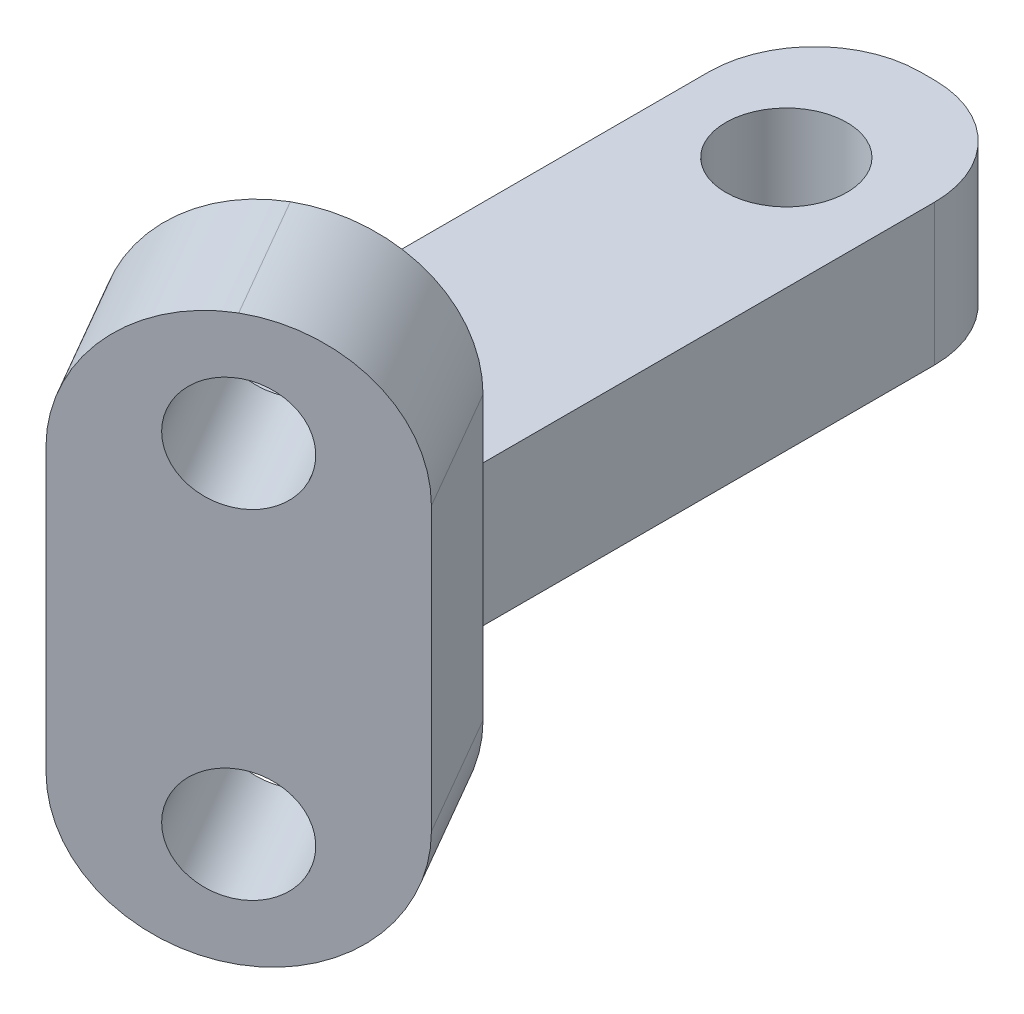
from build123d import *

# Parameters (mm, degrees)
SKETCH1_R           = 2.147718393
BOSS_EXTRUDE1_DEPTH = 5
SKETCH2_W           = 10
SKETCH2_H           = 20
BOSS_EXTRUDE2_DEPTH = 5
SKETCH3_R           = 2
CUT_EXTRUDE1_DEPTH  = 5
FILLET1_R           = 5


with BuildPart() as part:
    # Sketch1 → Boss-Extrude1 (new body)
    with BuildSketch(Plane(origin=(0, 0, 0), x_dir=(1, 0, 0), z_dir=(0, 1, 0))):
        with BuildLine():
            Line((-4, -20), (4, -15.381197846))
            Line((4, -15.381197846), (4, -5))
            Line((4, -5), (4, 1.25))
            ThreePointArc((4, 1.25), (2.901650429, 3.901650429), (0.25, 5))
            Line((0.25, 5), (-0.25, 5))
            ThreePointArc((-0.25, 5), (-2.901650429, 3.901650429), (-4, 1.25))
            Line((-4, 1.25), (-4, -5))
            Line((-4, -5), (-4, -20))
        make_face()
        with Locations(Location((0, 0, 0), (0, 0, 270))):
            Circle(SKETCH1_R, mode=Mode.SUBTRACT)
    extrude(amount=BOSS_EXTRUDE1_DEPTH)

    # Sketch2 → Boss-Extrude2 (add)
    with BuildSketch(Plane(origin=(7.660254038, 0, 13.267949192), x_dir=(0.8660254037844382, 0, -0.500000000000001), z_dir=(0.5000000000000009, 0, 0.866025403784438))):
        with Locations((-8.764101615, 2.5)):
            Rectangle(SKETCH2_W, SKETCH2_H)
    extrude(amount=BOSS_EXTRUDE2_DEPTH)

    # Sketch3 → Cut-Extrude1 (cut)
    with BuildSketch(Plane(origin=(7.660254038, 0, 13.267949192), x_dir=(-0.8660254037844382, 0, 0.5000000000000009), z_dir=(-0.5000000000000009, 0, -0.8660254037844383))):
        with Locations((8.764101615, -3.5)):
            Circle(SKETCH3_R)
        with Locations((8.764101615, 8.5)):
            Circle(SKETCH3_R)
    extrude(amount=-CUT_EXTRUDE1_DEPTH, mode=Mode.SUBTRACT)

    # Fillet1
    fillet1_edges = [part.edges().sort_by_distance(p)[0] for p in [
        (5.650446417, 12.5, 17.315063509),
        (-3.009807621, 12.5, 22.315063509),
        (5.650446417, -7.5, 17.315063509),
        (-3.009807621, -7.5, 22.315063509),
    ]]
    fillet(fillet1_edges, radius=FILLET1_R - 0.0001)  # a hair under: the kernel refuses the full size


solid = part.part
